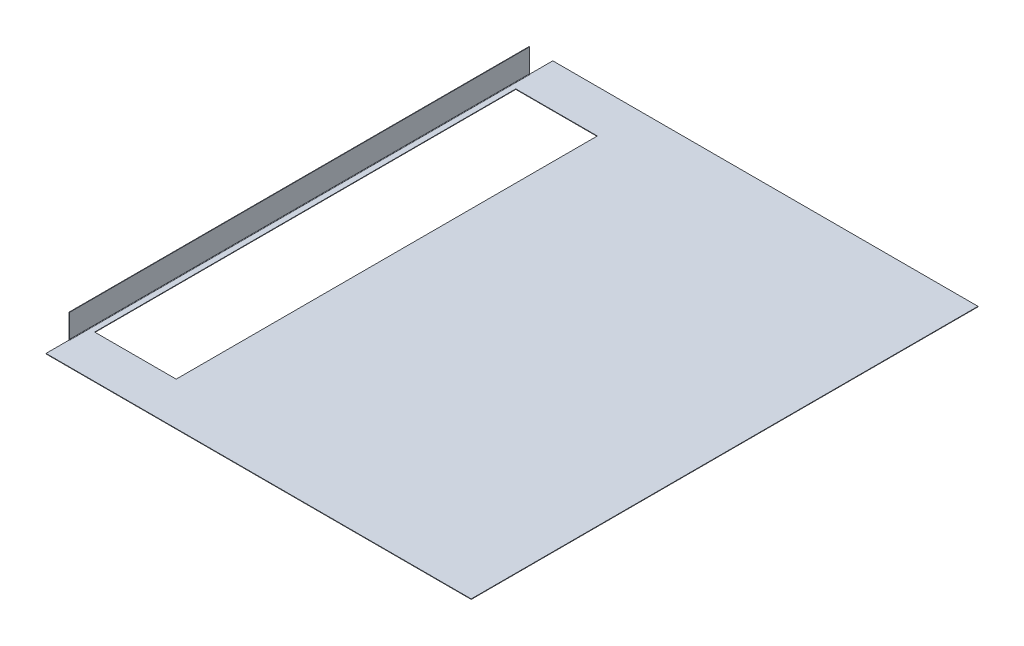
from build123d import *

# Parameters (mm, degrees)
SKETCH1_W                    = 730
SKETCH1_H                    = 870
SKETCH1_W_2                  = 140
SKETCH1_H_2                  = 723
BASE_FLANGE1_DEPTH           = 0.8
EDGE_FLANGE1_STRIP_W         = 4.8
EDGE_FLANGE1_STRIP_H         = 0.8
EDGE_FLANGE1_STRIP_CUT_DEPTH = 790
EDGE_FLANGE1_DEPTH           = 790


# Sheet-metal steps are written as plain solids
with BuildPart() as part:
    # Sketch1 → Base-Flange1 (new body)
    with BuildSketch(Plane(origin=(0, 0, 0), x_dir=(1, 0, 0), z_dir=(0, 1, 0))):
        Rectangle(SKETCH1_W, SKETCH1_H)
        with Locations((-285, 0)):
            Rectangle(SKETCH1_W_2, SKETCH1_H_2, mode=Mode.SUBTRACT)
    extrude(amount=-BASE_FLANGE1_DEPTH)

    # Edge-Flange1 strip (across the edge) → Edge-Flange1 strip cut (cut)
    with BuildSketch(Plane(origin=(-365, 0, -395), x_dir=(1, 0, 0), z_dir=(0, 0, 1))):
        with Locations((-1.6, -0.4)):
            Rectangle(EDGE_FLANGE1_STRIP_W, EDGE_FLANGE1_STRIP_H)
    extrude(amount=EDGE_FLANGE1_STRIP_CUT_DEPTH, mode=Mode.SUBTRACT)

    # Edge-Flange1 section (across the edge) → Edge-Flange1 (add)
    with BuildSketch(Plane(origin=(-365, 0, -395), x_dir=(1, 0, 0), z_dir=(0, 0, 1))):
        with BuildLine():
            Line((-0.8, 0.8), (-0.8, 40.8))
            Line((-0.8, 40.8), (0, 40.8))
            Line((0, 40.8), (0, 0.8))
            ThreePointArc((0, 0.8), (0.234314575, 0.234314575), (0.8, 0))
            Line((0.8, 0), (0.8, -0.8))
            ThreePointArc((0.8, -0.8), (-0.33137085, -0.33137085), (-0.8, 0.8))
        make_face()
    extrude(amount=EDGE_FLANGE1_DEPTH)


solid = part.part
